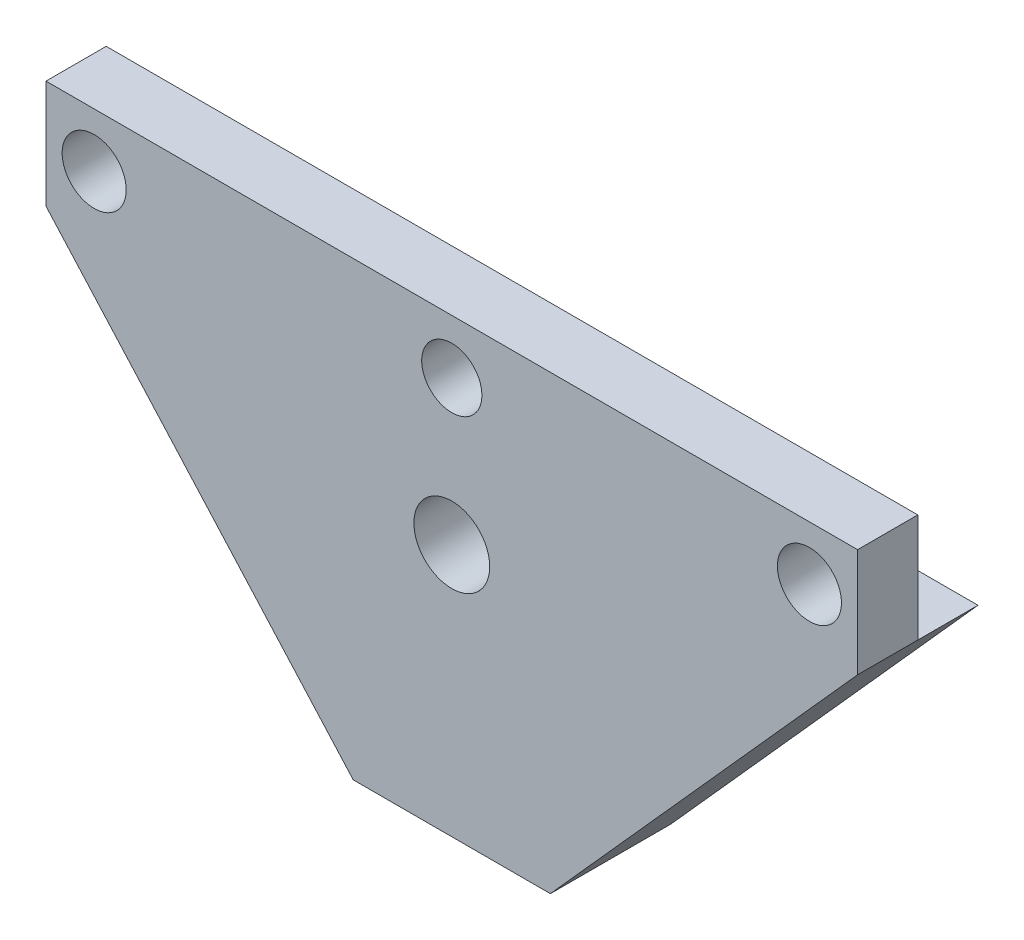
from build123d import *

# Parameters (mm, degrees)
BOSS_EXTRUDE1_DEPTH     = 12.7
SKETCH2_R               = 3.175
CUT_EXTRUDE1_DEPTH      = 62.233889922
SKETCH3_W               = 6.35
SKETCH3_H               = 11.43
CUT_EXTRUDE2_DEPTH      = 97.151665612
SKETCH4_R               = 4
CUT_EXTRUDE3_DEPTH      = 62.233889922
F_1_4_CLEARANCE_HOLE1_D = 6.7564


with BuildPart() as part:
    # Sketch1 → Boss-Extrude1 (new body)
    with BuildSketch(Plane.XY):
        Polygon((-42.800130549, -5.715), (-10.39539802, -41.91), (10.39539802, -41.91), (42.800130549, -5.715), (42.800130549, 5.715), (-42.800130549, 5.715), align=None)
    extrude(amount=-BOSS_EXTRUDE1_DEPTH)

    # Sketch2 → Cut-Extrude1 (cut, through all)
    with BuildSketch(Plane.XY):
        Circle(SKETCH2_R)
    extrude(amount=-CUT_EXTRUDE1_DEPTH, mode=Mode.SUBTRACT)

    # Sketch3 → Cut-Extrude2 (cut, through all)
    with BuildSketch(Plane(origin=(42.800130549, 0, 0), x_dir=(0, 0, -1), z_dir=(1, 0, 0))):
        with Locations((9.525, 0)):
            Rectangle(SKETCH3_W, SKETCH3_H)
    extrude(amount=-CUT_EXTRUDE2_DEPTH, mode=Mode.SUBTRACT)

    # Sketch4 → Cut-Extrude3 (cut, through all)
    with BuildSketch(Plane.XY):
        with Locations((0, -15.24)):
            Circle(SKETCH4_R)
    extrude(amount=-CUT_EXTRUDE3_DEPTH, mode=Mode.SUBTRACT)

    # 1/4 Clearance Hole1 (through all)
    with Locations(Plane(origin=(0, 0, -6.35), x_dir=(-1, 0, 0), z_dir=(0, 0, -1))):
        with Locations((-37.720130549, 0), (37.720130549, 0)):
            Hole(F_1_4_CLEARANCE_HOLE1_D / 2)


solid = part.part
